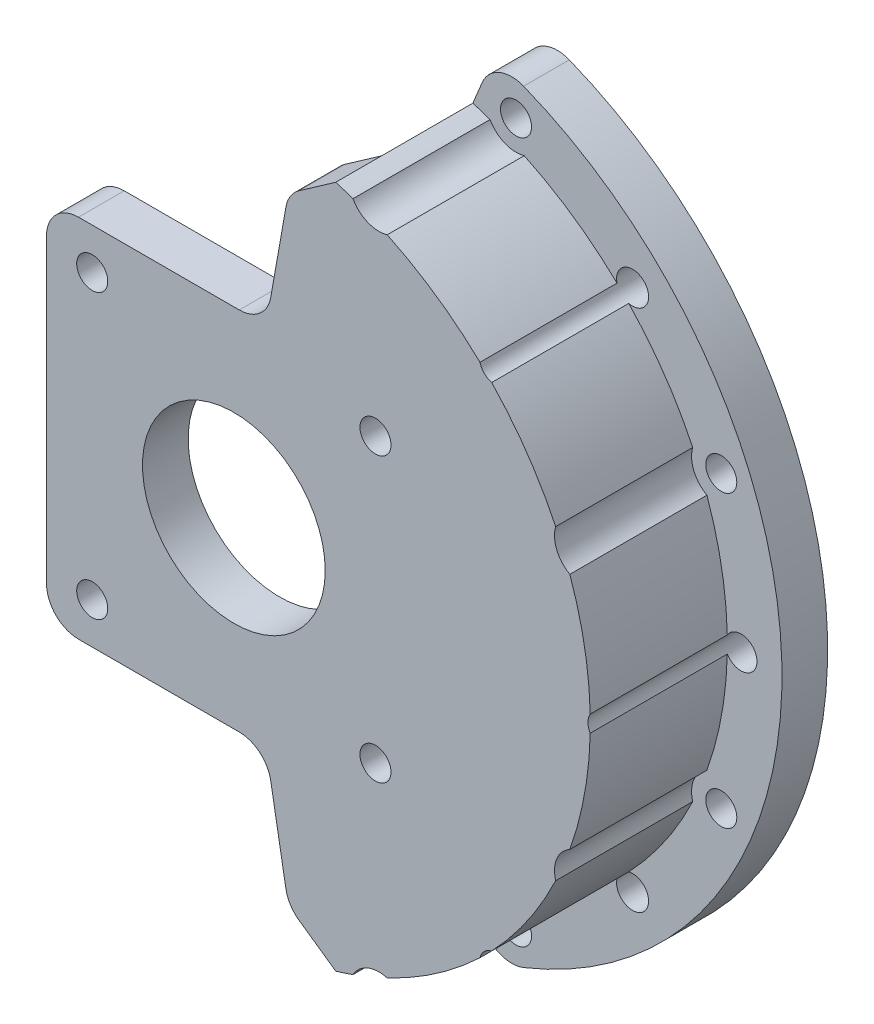
from build123d import *

# Parameters (mm, degrees)
CROQUIS1_R              = 1.7
SALIENTE_EXTRUIR1_DEPTH = 5
CROQUIS2_R              = 39.012383989
SALIENTE_EXTRUIR2_DEPTH = 20
CORTAR_EXTRUIR1_START   = -5
CROQUIS3_R              = 1.7
CROQUIS3_R_2            = 10
CORTAR_EXTRUIR1_DEPTH   = 5
CORTAR_EXTRUIR2_DEPTH   = 15
CHAFL_N1_SIZE           = 4.75
REDONDEO2_R             = 3.5
CROQUIS5_R              = 3.25
CORTAR_EXTRUIR3_DEPTH   = 15
MATRIZC1_COUNT          = 4
MATRIZC1_ANGLE          = 135
CROQUIS6_R              = 3.25
CORTAR_EXTRUIR4_DEPTH   = 2.5
CHAFL_N4_SIZE           = 2
CROQUIS8_R              = 1.75
CORTAR_EXTRUIR5_DEPTH   = 32.5


with BuildPart() as part:
    # Croquis1 → Saliente-Extruir1 (new body)
    with BuildSketch(Plane.XY):
        with BuildLine():
            Line((13.451293891, 42.926799862), (10.772509864, 36.459643134))
            ThreePointArc((10.772509864, 36.459643134), (38.017792496, 0), (10.772509864, -36.459643134))
            Line((10.772509864, -36.459643134), (13.451293891, -42.926799862))
            ThreePointArc((13.451293891, -42.926799862), (44.984969198, 0), (13.451293891, 42.926799862))
        make_face()
        with Locations((15.881362443, 38.341000599)):
            Circle(CROQUIS1_R, mode=Mode.SUBTRACT)
        with Locations((38.341000599, 15.881362443)):
            Circle(CROQUIS1_R, mode=Mode.SUBTRACT)
        with Locations((38.341000599, -15.881362443)):
            Circle(CROQUIS1_R, mode=Mode.SUBTRACT)
        with Locations((15.881362443, -38.341000599)):
            Circle(CROQUIS1_R, mode=Mode.SUBTRACT)
    extrude(amount=SALIENTE_EXTRUIR1_DEPTH)

    # Croquis2 → Saliente-Extruir2 (add)
    with BuildSketch(Plane(origin=(0, 0, 0), x_dir=(-1, 0, 0), z_dir=(0, 0, -1))):
        Circle(CROQUIS2_R)
    extrude(amount=-SALIENTE_EXTRUIR2_DEPTH)

    # Croquis3 → Cortar-Extruir1 (cut)
    with BuildSketch(Plane.XY.offset(20).offset(CORTAR_EXTRUIR1_START)):
        with Locations((-15.5, 15.5)):
            Circle(CROQUIS3_R)
        with Locations((15.5, 15.5)):
            Circle(CROQUIS3_R)
        with Locations((15.5, -15.5)):
            Circle(CROQUIS3_R)
        with Locations((-15.5, -15.5)):
            Circle(CROQUIS3_R)
        Circle(CROQUIS3_R_2)
        with BuildLine():
            Line((-20.5, 20), (-20.5, -20))
            Line((-20.5, -20), (3.526539614, -20))
            Line((3.526539614, -20), (6.774429386, -38.419698215))
            ThreePointArc((6.774429386, -38.419698215), (-39.012383989, 0), (6.774429386, 38.419698215))
            Line((6.774429386, 38.419698215), (3.526539614, 20))
            Line((3.526539614, 20), (-20.5, 20))
        make_face()
    extrude(amount=CORTAR_EXTRUIR1_DEPTH, mode=Mode.SUBTRACT)

    # Croquis4 → Cortar-Extruir2 (cut)
    with BuildSketch(Plane(origin=(0, 0, 0), x_dir=(-1, 0, 0), z_dir=(0, 0, -1))):
        with BuildLine():
            Line((-13.451293891, 42.926799862), (-11.155193297, 37.383522667))
            Line((-11.155193297, 37.383522667), (-9.803229729, 34.119593885))
            ThreePointArc((-9.803229729, 34.119593885), (-35.5, 0), (-9.803229729, -34.119593885))
            Line((-9.803229729, -34.119593885), (-11.155193297, -37.383522667))
            Line((-11.155193297, -37.383522667), (-13.451293891, -42.926799862))
            ThreePointArc((-13.451293891, -42.926799862), (44.984969198, 0), (-13.451293891, 42.926799862))
        make_face()
    extrude(amount=-CORTAR_EXTRUIR2_DEPTH, mode=Mode.SUBTRACT)

    # Chaflán1
    # the kernel refuses this chamfer: 4.75 mm, written as the material it takes off along each edge
    with BuildSketch(Plane(origin=(6.774429386, -38.419698215, 2.784505807), x_dir=(0.973158962162818, 0.2301339487389611, 0), z_dir=(0, 0, 1))) as chafl_n1_piece_1:
        with BuildLine():
            Line((4.498160378, 0), (CHAFL_N1_SIZE * 0.0576504165896, CHAFL_N1_SIZE * 0.998336831669))
            Line((CHAFL_N1_SIZE * 0.0576504165896, CHAFL_N1_SIZE * 0.998336831669), (0, 0))
            ThreePointArc((0, 0), (2.312261051, -0.064833001), (4.498160378, 0))
        make_face()
    extrude(amount=29.430988386, mode=Mode.SUBTRACT)
    with BuildSketch(Plane(origin=(6.774429386, 38.419698215, 2.784505807), x_dir=(0.9731589621628183, -0.23013394873896015, 0), z_dir=(0, 0, 1))) as chafl_n1_piece_2:
        with BuildLine():
            Line((4.498160378, 0), (CHAFL_N1_SIZE * 0.0576504165896, -CHAFL_N1_SIZE * 0.998336831669))
            Line((CHAFL_N1_SIZE * 0.0576504165896, -CHAFL_N1_SIZE * 0.998336831669), (0, 0))
            ThreePointArc((0, 0), (2.312261051, 0.064833001), (4.498160378, 0))
        make_face()
    extrude(amount=29.430988386, mode=Mode.SUBTRACT)

    # Redondeo2
    redondeo2_edges = [part.edges().sort_by_distance(p)[0] for p in [
        (5.949600542, 33.741861389, 17.5),
        (5.949600542, -33.741861389, 17.5),
        (3.526539614, 20, 17.5),
        (-20.5, 20, 17.5),
        (-20.5, -20, 17.5),
        (3.526539614, -20, 17.5),
        (13.451293891, -42.926799862, 2.5),
        (13.451293891, 42.926799862, 2.5),
    ]]
    fillet(redondeo2_edges, radius=REDONDEO2_R)

    # Croquis5 → Cortar-Extruir3 (cut)
    with BuildSketch(Plane.XY.offset(5)):
        with Locations((15.881362443, -38.341000599)):
            Circle(CROQUIS5_R)
    cortar_extruir3 = extrude(amount=CORTAR_EXTRUIR3_DEPTH, mode=Mode.SUBTRACT)

    # MatrizC1: Cortar-Extruir3 ×4 about axis
    matrizc1_axis = Axis((0, 0, 0), (0, 0, 1))
    for i in range(1, MATRIZC1_COUNT):
        add(cortar_extruir3.rotate(matrizc1_axis, i * MATRIZC1_ANGLE / (MATRIZC1_COUNT - 1)), mode=Mode.SUBTRACT)

    # Croquis6 → Cortar-Extruir4 (cut)
    with BuildSketch(Plane(origin=(0, 0, 15), x_dir=(-1, 0, 0), z_dir=(0, 0, -1))):
        with Locations((15.5, 15.5)):
            Circle(CROQUIS6_R)
        with Locations((15.5, -15.5)):
            Circle(CROQUIS6_R)
        with Locations((-15.5, -15.5)):
            Circle(CROQUIS6_R)
        with Locations((-15.5, 15.5)):
            Circle(CROQUIS6_R)
    extrude(amount=-CORTAR_EXTRUIR4_DEPTH, mode=Mode.SUBTRACT)

    # Chaflán4
    chafl_n4_edges = [part.edges().sort_by_distance(p)[0] for p in [
        (35.5, 0, 15),
    ]]
    chamfer(chafl_n4_edges, length=CHAFL_N4_SIZE)

    # Croquis8 → Cortar-Extruir5 (cut)
    with BuildSketch(Plane(origin=(0, 0, 0), x_dir=(-1, 0, 0), z_dir=(0, 0, -1))):
        with Locations((-40.5, 0)):
            Circle(CROQUIS8_R)
        with Locations(Location((-28.637824638, -28.637824638, 0), (0, 0, 13.876951429))):
            Circle(CROQUIS8_R)
        with Locations((-28.637824638, 28.637824638)):
            Circle(CROQUIS8_R)
    extrude(amount=-CORTAR_EXTRUIR5_DEPTH, mode=Mode.SUBTRACT)


solid = part.part
